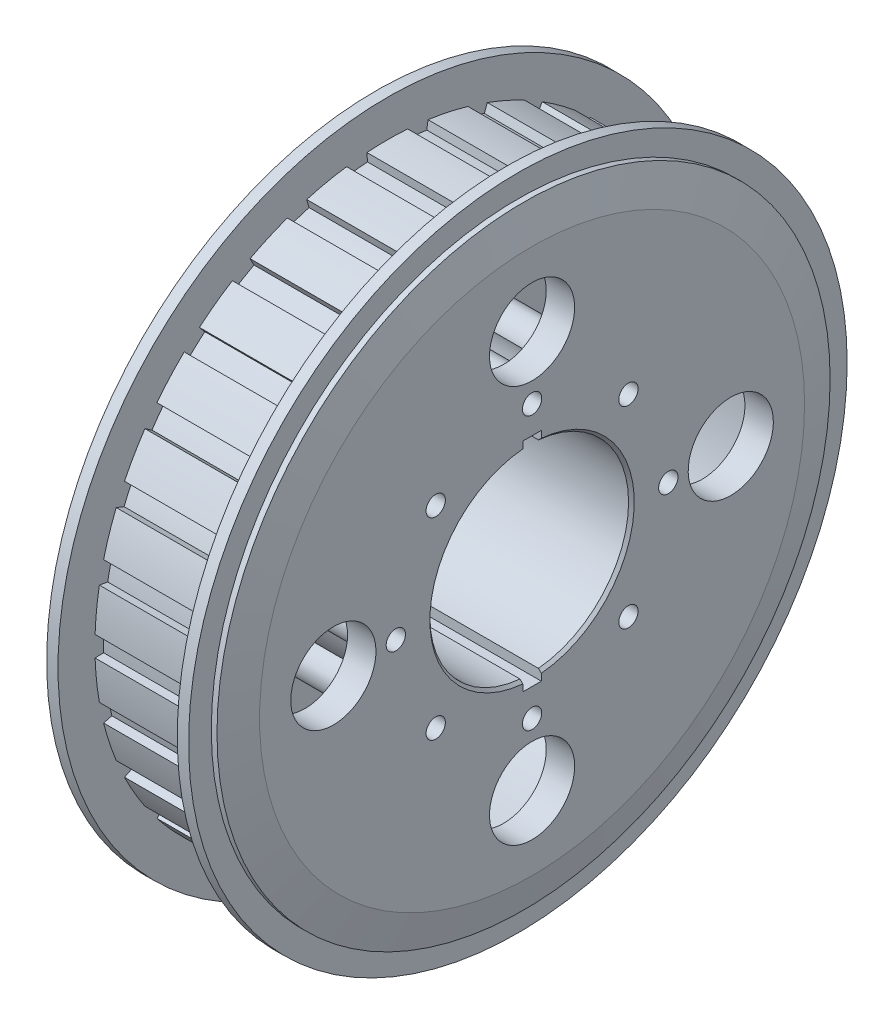
from build123d import *

# Parameters (mm, degrees)
BOSS_EXTRUDE1_START = -10.5
BOSS_EXTRUDE1_DEPTH = 10.5
CIRPATTERN1_COUNT   = 30
CHAMFER1_SIZE       = 0.5
SHELL1_START        = -10
SHELL1_OUTLINE_R    = 45
SHELL1_OUTLINE_R_2  = 22.5
SHELL1_DEPTH        = 10
SKETCH3_R           = 7.5
CUT_EXTRUDE1_DEPTH  = 88.338422244
CIRPATTERN2_COUNT   = 4
SKETCH4_R           = 1.7
CUT_EXTRUDE2_DEPTH  = 88.338422244
SKETCH5_R           = 3.25
SKETCH5_R_2         = 1.7
BOSS_EXTRUDE2_DEPTH = 30
CIRPATTERN3_COUNT   = 8
SKETCH6_W           = 3.25
SKETCH6_H           = 3.25
CUT_EXTRUDE3_DEPTH  = 88.338422244
CIRPATTERN4_COUNT   = 2


# Read off the part's stored shape, not the designer's step: Shell1
with BuildPart() as part:
    # Sketch1 → Revolve1 (revolve)
    with BuildSketch(Plane.XY, mode=Mode.PRIVATE) as revolve1_sk:
        Polygon((0, 17.5), (0, 50), (-10.5, 50), (-10.5, 58), (-12.5, 58), (-12.5, 54), (-13.5, 54), (-15, 48), (-15, 17.5), align=None)
    revolve(revolve1_sk.sketch.rotate(Axis((0, 0, 0), (-1, 0, 0)), 90), axis=Axis((0, 0, 0), (-1, 0, 0)))

    # Sketch2 → Boss-Extrude1 (add)
    with BuildSketch(Plane(origin=(0, 0, 0), x_dir=(0, 0, -1), z_dir=(1, 0, 0)).offset(BOSS_EXTRUDE1_START)):
        with BuildLine():
            ThreePointArc((0, 50), (1.744974835, 49.969541351), (3.487823687, 49.878202513))
            Line((3.487823687, 49.878202513), (3.592458398, 51.374548588))
            ThreePointArc((3.592458398, 51.374548588), (1.79732408, 51.468627591), (0, 51.5))
            Line((0, 51.5), (0, 50))
        make_face()
        with BuildLine():
            ThreePointArc((-3.487823687, 49.878202513), (-1.744974835, 49.969541351), (0, 50))
            Line((0, 50), (0, 51.5))
            ThreePointArc((0, 51.5), (-1.79732408, 51.468627591), (-3.592458398, 51.374548588))
            Line((-3.592458398, 51.374548588), (-3.487823687, 49.878202513))
        make_face()
    boss_extrude1 = extrude(amount=BOSS_EXTRUDE1_DEPTH)

    # CirPattern1: Boss-Extrude1 ×30 about axis
    cirpattern1_axis = Axis((0, 0, 0), (1, 0, 0))
    for i in range(1, CIRPATTERN1_COUNT):
        add(boss_extrude1.rotate(cirpattern1_axis, i * 360 / CIRPATTERN1_COUNT))

    # Chamfer1
    chamfer1_edges = [part.edges().sort_by_distance(p)[0] for p in [
        (-15, 0, 17.5),
    ]]
    chamfer(chamfer1_edges, length=CHAMFER1_SIZE)

    # Shell1 outline → Shell1 (cut)
    with BuildSketch(Plane.YZ.offset(SHELL1_START)):
        Circle(SHELL1_OUTLINE_R)
        Circle(SHELL1_OUTLINE_R_2, mode=Mode.SUBTRACT)
    extrude(amount=SHELL1_DEPTH, mode=Mode.SUBTRACT)

    # Mirror1: part across face


with BuildPart() as part_1:
    add(part.part)
    add(part.part.mirror(Plane(origin=(0, 0, 0), x_dir=(0, 0, 1), z_dir=(1, 0, 0))))

    # Sketch3 → Cut-Extrude1 (cut, symmetric)
    with BuildSketch(Plane.ZY.offset(15)):
        with Locations((0, 35)):
            Circle(SKETCH3_R)
    cut_extrude1 = extrude(amount=CUT_EXTRUDE1_DEPTH, both=True, mode=Mode.SUBTRACT)

    # CirPattern2: Cut-Extrude1 ×4 about axis
    cirpattern2_axis = Axis((0, 0, 0), (1, 0, 0))
    for i in range(1, CIRPATTERN2_COUNT):
        add(cut_extrude1.rotate(cirpattern2_axis, i * 360 / CIRPATTERN2_COUNT), mode=Mode.SUBTRACT)

    # Sketch4 → Cut-Extrude2 (cut, through all)
    with BuildSketch(Plane(origin=(15, 0, 0), x_dir=(0, 0, -1), z_dir=(1, 0, 0))):
        with Locations((0, 24)):
            Circle(SKETCH4_R)
    cut_extrude2 = extrude(amount=-CUT_EXTRUDE2_DEPTH, mode=Mode.SUBTRACT)

    # Sketch5 → Boss-Extrude2 (add)
    with BuildSketch(Plane(origin=(15, 0, 0), x_dir=(0, 0, -1), z_dir=(1, 0, 0))):
        with Locations((0, 24)):
            Circle(SKETCH5_R)
        with Locations((0, 24)):
            Circle(SKETCH5_R_2, mode=Mode.SUBTRACT)
    boss_extrude2 = extrude(amount=-BOSS_EXTRUDE2_DEPTH)

    # CirPattern3: Cut-Extrude2, Boss-Extrude2 ×8 about axis
    cirpattern3_axis = Axis((0, 0, 0), (1, 0, 0))
    add([cut_extrude2.rotate(cirpattern3_axis, i * 360 / CIRPATTERN3_COUNT) for i in range(1, CIRPATTERN3_COUNT)], mode=Mode.SUBTRACT)
    add([boss_extrude2.rotate(cirpattern3_axis, i * 360 / CIRPATTERN3_COUNT) for i in range(1, CIRPATTERN3_COUNT)])

    # Sketch6 → Cut-Extrude3 (cut, through all)
    with BuildSketch(Plane(origin=(15, 0, 0), x_dir=(0, 0, -1), z_dir=(1, 0, 0))):
        with Locations((0, 17.5)):
            Rectangle(SKETCH6_W, SKETCH6_H)
    cut_extrude3 = extrude(amount=-CUT_EXTRUDE3_DEPTH, mode=Mode.SUBTRACT)

    # CirPattern4: Cut-Extrude3 ×2 about axis
    cirpattern4_axis = Axis((0, 0, 0), (1, 0, 0))
    for i in range(1, CIRPATTERN4_COUNT):
        add(cut_extrude3.rotate(cirpattern4_axis, i * 360 / CIRPATTERN4_COUNT), mode=Mode.SUBTRACT)


solid = part_1.part
